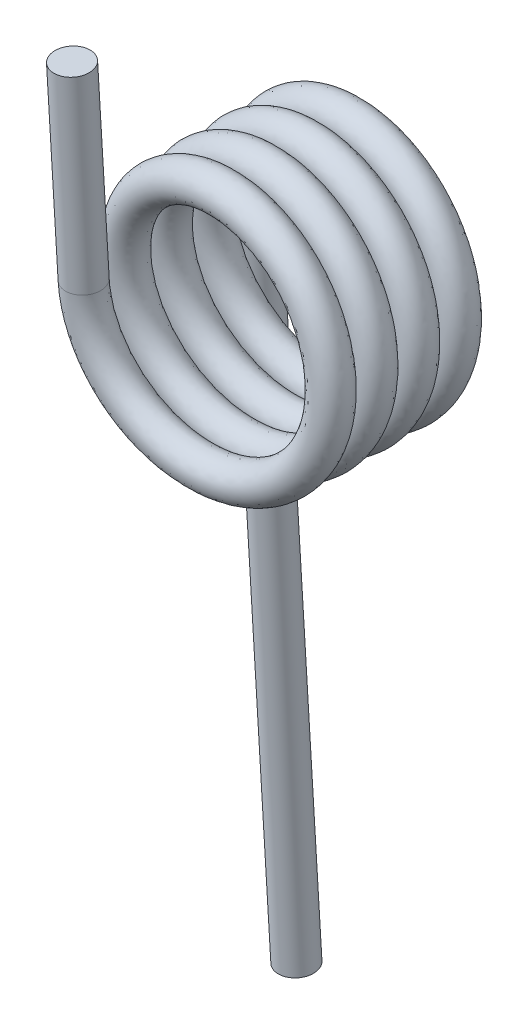
from build123d import *

# Parameters (mm, degrees)
SWEEP1_PITCH        = 15
SWEEP1_HEIGHT       = 60
SWEEP1_RADIUS       = 40
SWEEP1_START_ANGLE  = 180
SKETCH3_R           = 6.5
SKETCH6_R           = 6.5
BOSS_EXTRUDE3_DEPTH = 70
SKETCH7_R           = 6.5
BOSS_EXTRUDE4_DEPTH = 250


with BuildPart() as part:
    # Sweep1: sweep along a helix
    with BuildLine() as sweep1_path:
        add(Helix(SWEEP1_PITCH, SWEEP1_HEIGHT, SWEEP1_RADIUS, center=(0, 0, 0), direction=(0, 0, 1), lefthand=True, mode=Mode.PRIVATE).rotate(Axis((0, 0, 0), (0, 0, 1)), SWEEP1_START_ANGLE))
    # Sketch3 → Sweep1 (sweep)
    with BuildSketch(Plane(origin=(-40, 0, 60), x_dir=(-0.9706690018822969, 0.014323512885928964, -0.23999276189800448), z_dir=(5.103382993976169e-14, 0.9982237076247992, 0.059577089017504026))):
        with Locations((0.542774317, 0.272611249)):
            Circle(SKETCH3_R)
    sweep(path=sweep1_path.line, is_frenet=True)

    # Sketch6 → Boss-Extrude3 (add)
    with BuildSketch(Plane(origin=(0, 3.568275761, 0.212965772), x_dir=(-0.9706690018823321, 0.014323512885920526, -0.23999276189786267), z_dir=(5.104944245104548e-14, 0.9982237076247993, 0.05957708901750407))):
        with Locations((24.969968678, 68.026092557)):
            Circle(SKETCH6_R)
    extrude(amount=BOSS_EXTRUDE3_DEPTH)

    # Sketch7 → Boss-Extrude4 (add)
    with BuildSketch(Plane(origin=(0, 0, 0), x_dir=(1, 0, 0), z_dir=(-5.104151108379668e-14, -0.9982237076247993, -0.05957708901750405))):
        with Locations((-39.457225683, -0.272611249)):
            Circle(SKETCH7_R)
    extrude(amount=BOSS_EXTRUDE4_DEPTH)


solid = part.part
